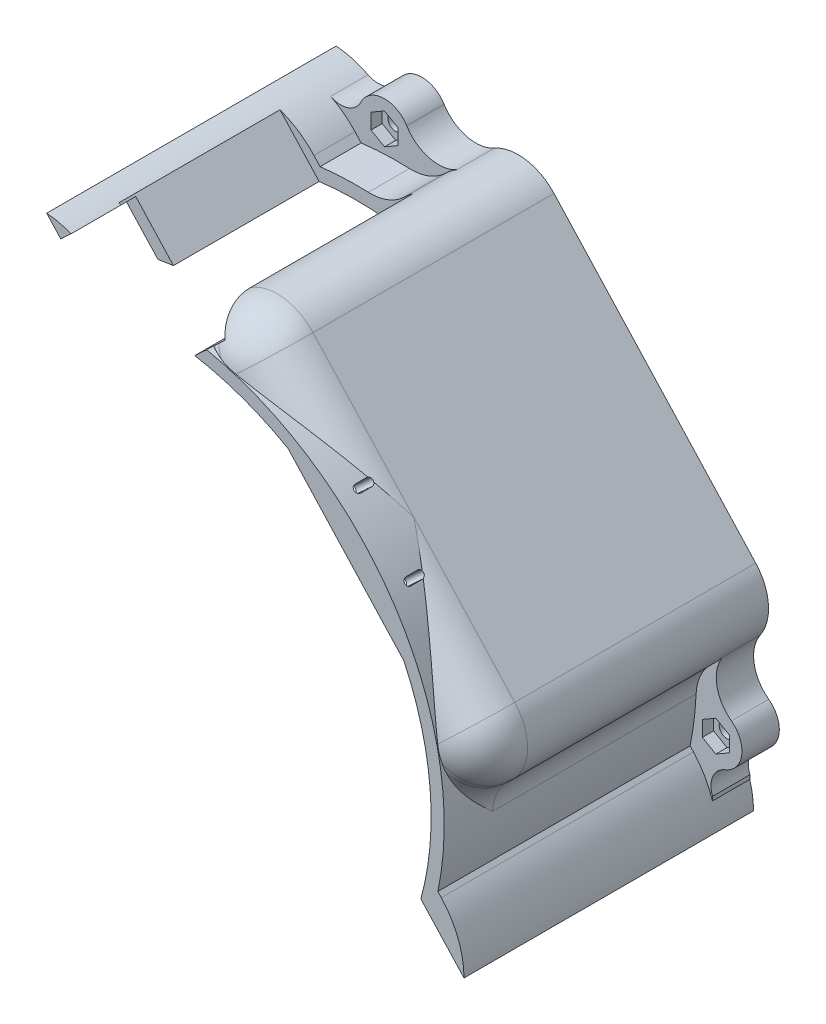
from build123d import *

# Parameters (mm, degrees)
SKETCH1_R               = 80
BOSS_EXTRUDE1_DEPTH     = 77.5
CUT_EXTRUDE1_DEPTH      = 136
BOSS_EXTRUDE3_DEPTH     = 77.5
BOSS_EXTRUDE4_DEPTH     = 30
FILLET4_R               = 13
FILLET5_R               = 13
BOSS_EXTRUDE5_DEPTH     = 60
CUT_EXTRUDE4_DEPTH      = 64
CUT_EXTRUDE5_DEPTH      = 59
SKETCH13_W              = 25
SKETCH13_H              = 43
CUT_EXTRUDE6_DEPTH      = 59
BOSS_EXTRUDE7_DEPTH     = 77.5
FILLET6_R               = 23
SKETCH15_W              = 25
SKETCH15_H              = 43.071374797
CUT_EXTRUDE7_DEPTH      = 59
CUT_EXTRUDE8_DEPTH      = 59
CUT_EXTRUDE9_DEPTH      = 84
CUT_EXTRUDE9_DEPTH_BACK = 59
CUT_EXTRUDE11_START     = -28.5
SKETCH18_W              = 30.45186069
SKETCH18_H              = 31
CUT_EXTRUDE11_DEPTH     = 28.5
BOSS_EXTRUDE8_START     = -10
SKETCH19_R              = 2.1
BOSS_EXTRUDE8_DEPTH     = 10
CUT_EXTRUDE12_DEPTH     = 3
CUT_EXTRUDE13_DEPTH     = 52
CUT_EXTRUDE15_START     = -74
CUT_EXTRUDE15_DEPTH     = 74
BOSS_EXTRUDE9_START     = -10
BOSS_EXTRUDE9_DEPTH     = 10


with BuildPart() as part:
    # Sketch1 → Boss-Extrude1 (new body)
    with BuildSketch(Plane.XY):
        Circle(SKETCH1_R)
    extrude(amount=-BOSS_EXTRUDE1_DEPTH)

    # Sketch2 → Cut-Extrude1 (cut)
    with BuildSketch(Plane.XY):
        Polygon((200.832620589, -158.529615693), (-139.779380555, 211.802473813), (-214.946113506, 22.839930093), (4.101583011, -190.386425583), align=None)
    extrude(amount=-CUT_EXTRUDE1_DEPTH, mode=Mode.SUBTRACT)

    # Sketch3 → Boss-Extrude3 (add)
    with BuildSketch(Plane(origin=(0, 0, -77.5), x_dir=(-1, 0, 0), z_dir=(0, 0, -1))):
        Polygon((-94.683885577, 15.230570574), (-23.079893303, 93.082366714), (-8.377765785, 79.560122175), (-79.981758059, 1.708326035), align=None)
    extrude(amount=-BOSS_EXTRUDE3_DEPTH)

    # Sketch7 → Boss-Extrude4 (add)
    with BuildSketch(Plane.XY):
        with BuildLine():
            Line((76.512778485, -23.362250072), (-16.894865428, 78.195674575))
            ThreePointArc((-16.894865428, 78.195674575), (58.88188944, 54.156468644), (76.512778485, -23.362250072))
        make_face()
    extrude(amount=-BOSS_EXTRUDE4_DEPTH)

    # Fillet4
    fillet4_edges = [part.edges().sort_by_distance(p)[0] for p in [
        (94.683885577, 15.230570574, -38.75),
        (79.981758059, 1.708326035, -38.75),
        (23.079893303, 93.082366714, -38.75),
        (8.377765785, 79.560122175, -38.75),
    ]]
    fillet(fillet4_edges, radius=FILLET4_R)

    # Fillet5
    # the kernel refuses this fillet: 13 mm, written as the material it takes off along each edge
    with BuildSketch(Plane(origin=(0, 0, 0), x_dir=(-0.5802553628668502, 0.8144345976591737, 0), z_dir=(-0.8144345976591737, -0.5802553628668502, 0))) as fillet5_piece_1:
        with BuildLine():
            CenterArc((80 - FILLET5_R, FILLET5_R), FILLET5_R, 270, 90)
            Line((80 - FILLET5_R, 0), (80, 0))
            Line((80, 0), (80, FILLET5_R))
        make_face()
    revolve(axis=Axis((0, 0, 0), (0, 0, -1)), revolution_arc=37.752557482, mode=Mode.SUBTRACT)
    with BuildSketch(Plane(origin=(13.511586269, 84.281940559, 0), x_dir=(0.6769558580513358, -0.7360236179973981, 0), z_dir=(-0.736023617997398, -0.6769558580513357, 0)), Plane(origin=(84.110809708, 5.506010829, 0), x_dir=(-0.676955858051335, 0.7360236179973988, 0), z_dir=(0.7360236179973989, 0.676955858051335, 0))) as fillet5_piece_2:
        with BuildLine():
            CenterArc((FILLET5_R, -FILLET5_R), FILLET5_R, 90, 90)
            Line((0, -FILLET5_R), (0, 0))
            Line((0, 0), (FILLET5_R, 0))
        make_face()
    extrude(amount=1.36513124, mode=Mode.SUBTRACT)
    with BuildSketch(Plane(origin=(0, 0, 0), x_dir=(0.999045546911454, -0.043680604350144224, 0), z_dir=(0.043680604350144224, 0.999045546911454, 0))) as fillet5_piece_3:
        with BuildLine():
            CenterArc((80 - FILLET5_R, FILLET5_R), FILLET5_R, 270, 90)
            Line((80, FILLET5_R), (80, 0))
            Line((80, 0), (80 - FILLET5_R, 0))
        make_face()
    revolve(axis=Axis((0, 0, 0), (0, 0, -1)), revolution_arc=37.752557482, mode=Mode.SUBTRACT)
    with BuildSketch(Plane(origin=(85.883459422, 24.798877608, 0), x_dir=(-0.7360236179973982, -0.6769558580513356, 0), z_dir=(-0.6769558580513355, 0.7360236179973983, 0))) as fillet5_piece_4:
        with BuildLine():
            CenterArc((FILLET5_R, -FILLET5_R), FILLET5_R, 90, 90)
            Line((0, -FILLET5_R), (0, 0))
            Line((0, 0), (FILLET5_R, 0))
        make_face()
    extrude(amount=39.886751797, mode=Mode.SUBTRACT)
    with BuildSketch(Plane(origin=(76.315152388, 15.998451454, 0), x_dir=(0.7360236179973981, 0.6769558580513357, 0), z_dir=(-0.6769558580513357, 0.7360236179973981, 0))) as fillet5_piece_5:
        with BuildLine():
            CenterArc((13 - FILLET5_R, FILLET5_R), FILLET5_R, 270, 90)
            Line((13, FILLET5_R), (13, 0))
            Line((13, 0), (13 - FILLET5_R, 0))
        make_face()
    revolve(axis=Axis((76.315152388, 15.998451454, 0), (0, 0, -1)), revolution_arc=90, mode=Mode.SUBTRACT)
    with BuildSketch(Plane(origin=(22.312012424, 74.713633525, 0), x_dir=(-0.6769558580513356, 0.7360236179973982, 0), z_dir=(-0.7360236179973982, -0.6769558580513356, 0))) as fillet5_piece_6:
        with BuildLine():
            CenterArc((13 - FILLET5_R, FILLET5_R), FILLET5_R, 270, 90)
            Line((13, FILLET5_R), (13, 0))
            Line((13, 0), (13 - FILLET5_R, 0))
        make_face()
    revolve(axis=Axis((22.312012424, 74.713633525, 0), (0, 0, -1)), revolution_arc=90, mode=Mode.SUBTRACT)
    with BuildSketch(Plane(origin=(3.70639128, 92.926114003, 0), x_dir=(-0.03985366967250139, -0.9992055269130747, 0), z_dir=(-0.9992055269130747, 0.03985366967250139, 0))) as fillet5_piece_7:
        with BuildLine():
            CenterArc((13 + FILLET5_R, -FILLET5_R), FILLET5_R, 90, 90)
            Line((13 + FILLET5_R, 0), (13, 0))
            Line((13, 0), (13, -FILLET5_R))
        make_face()
    revolve(axis=Axis((3.70639128, 92.926114003, 0), (0, 0, 1)), revolution_arc=44.890270577, mode=Mode.SUBTRACT)
    with BuildSketch(Plane(origin=(92.911235863, -4.062296205, 0), x_dir=(-0.6769558580513347, 0.7360236179973989, 0), z_dir=(0.7360236179973989, 0.6769558580513347, 0))) as fillet5_piece_8:
        with BuildLine():
            CenterArc((13 + FILLET5_R, -FILLET5_R), FILLET5_R, 90, 90)
            Line((13, -FILLET5_R), (13, 0))
            Line((13, 0), (13 + FILLET5_R, 0))
        make_face()
    revolve(axis=Axis((92.911235863, -4.062296205, 0), (0, 0, 1)), revolution_arc=44.890270577, mode=Mode.SUBTRACT)
    with BuildSketch(Plane(origin=(58.881889134, 54.156468976, 0), x_dir=(-0.7360236179973983, -0.6769558580513355, 0), z_dir=(-0.6769558580513355, 0.7360236179973983, 0))) as fillet5_piece_9:
        with BuildLine():
            CenterArc((FILLET5_R, -FILLET5_R), FILLET5_R, 90, 90)
            Line((0, -FILLET5_R), (0, 0))
            Line((0, 0), (FILLET5_R, 0))
        make_face()
    extrude(amount=39.886750895, mode=Mode.SUBTRACT)

    # Sketch8 → Boss-Extrude5 (add)
    with BuildSketch(Plane.XY):
        with BuildLine():
            Line((76.512778485, -23.362250072), (-16.894865428, 78.195674575))
            ThreePointArc((-16.894865428, 78.195674575), (58.88188944, 54.156468644), (76.512778485, -23.362250072))
        make_face()
    extrude(amount=-BOSS_EXTRUDE5_DEPTH)

    # Sketch11 → Cut-Extrude4 (cut)
    with BuildSketch(Plane(origin=(0, 0, -77.5), x_dir=(-1, 0, 0), z_dir=(0, 0, -1))):
        Polygon((-58.901596867, -9.002725987), (-85.208171513, 15.192679401), (-22.251276714, 83.642875875), (4.819019891, 58.74503915), align=None)
    extrude(amount=-CUT_EXTRUDE4_DEPTH, mode=Mode.SUBTRACT)

    # Sketch12 → Cut-Extrude5 (cut)
    with BuildSketch(Plane(origin=(0, 0, -13.5), x_dir=(-1, 0, 0), z_dir=(0, 0, -1))):
        with BuildLine():
            Line((-66.017136448, 30.149422801), (-73.14823909, 22.396096045))
            ThreePointArc((-73.14823909, 22.396096045), (-75.069436362, 14.725139196), (-76.188474546, 6.896835965))
            Line((-76.188474546, 6.896835965), (-57.965768686, -9.863451585))
            Line((-57.965768686, -9.863451585), (-41.718828093, 7.801115247))
            Line((-41.718828093, 7.801115247), (-66.017136448, 30.149422801))
        make_face()
    extrude(amount=-CUT_EXTRUDE5_DEPTH, mode=Mode.SUBTRACT)

    # Sketch13 → Cut-Extrude6 (cut)
    with BuildSketch(Plane(origin=(-31.478447399, 34.225098237, 0), x_dir=(0.7360236179973982, 0.6769558580513356, 0), z_dir=(0.6769558580513356, -0.7360236179973982, 0))):
        with Locations((56.5, -35)):
            Rectangle(SKETCH13_W, SKETCH13_H)
    extrude(amount=-CUT_EXTRUDE6_DEPTH, mode=Mode.SUBTRACT)

    # Sketch14 → Boss-Extrude7 (add)
    with BuildSketch(Plane.XY):
        with BuildLine():
            Line((76.512778485, -23.362250072), (85.289803009, -32.905113567))
            Line((85.289803009, -32.905113567), (89.773193917, -28.781526138))
            Line((89.773193917, -28.781526138), (78.316574767, -16.325260081))
            ThreePointArc((78.316574767, -16.325260081), (77.494593129, -19.864240127), (76.512778485, -23.362250072))
        make_face()
        with BuildLine():
            Line((-16.894865428, 78.195674575), (-26.407913569, 88.538783403))
            Line((-26.407913569, 88.538783403), (-21.924522662, 92.662370832))
            Line((-21.924522662, 92.662370832), (-9.731879894, 79.405859442))
            ThreePointArc((-9.731879894, 79.405859442), (-13.327116285, 78.882114396), (-16.894865428, 78.195674575))
        make_face()
    extrude(amount=-BOSS_EXTRUDE7_DEPTH)

    # Fillet6
    # the kernel refuses this fillet: 23 mm, written as the material it takes off along each edge
    with BuildSketch(Plane(origin=(-21.924522662, 92.662370832, 38.97901461), x_dir=(0.6769558580513366, -0.7360236179973972, 0), z_dir=(0, 0, -1))) as fillet6_piece_1:
        with BuildLine():
            CenterArc((15.591605844, 23), FILLET6_R, 227.320560267, 42.679439733)
            Line((0, 6.091368263), (0, 0))
            Line((0, 0), (15.591605844, 0))
        make_face()
    extrude(amount=155.458029219, mode=Mode.SUBTRACT)
    with BuildSketch(Plane(origin=(89.773193917, -28.781526138, 38.97901461), x_dir=(-0.7360236179973998, -0.676955858051334, 0), z_dir=(0, 0, -1))) as fillet6_piece_2:
        with BuildLine():
            CenterArc((23, 15.591605844), FILLET6_R, 180, 42.679439733)
            Line((0, 15.591605844), (0, 0))
            Line((0, 0), (6.091368263, 0))
        make_face()
    extrude(amount=155.458029219, mode=Mode.SUBTRACT)

    # Sketch15 → Cut-Extrude7 (cut)
    with BuildSketch(Plane(origin=(-31.478447399, 34.225098237, 0), x_dir=(0.7360236179973982, 0.6769558580513356, 0), z_dir=(0.6769558580513356, -0.7360236179973982, 0))):
        with Locations((56.5, -34.964312601)):
            Rectangle(SKETCH15_W, SKETCH15_H)
    extrude(amount=-CUT_EXTRUDE7_DEPTH, mode=Mode.SUBTRACT)

    # Sketch16 → Cut-Extrude8 (cut)
    with BuildSketch(Plane(origin=(0, 0, -13.5), x_dir=(-1, 0, 0), z_dir=(0, 0, -1))):
        with BuildLine():
            Line((-66.017136448, 30.149422801), (-28.423020194, 71.023812366))
            ThreePointArc((-28.423020194, 71.023812366), (-20.939173384, 73.578536395), (-13.231579747, 75.347032439))
            Line((-13.231579747, 75.347032439), (1.66949087, 61.641810488))
            Line((1.66949087, 61.641810488), (-45.040463335, 10.856180846))
            Line((-45.040463335, 10.856180846), (-66.017136448, 30.149422801))
        make_face()
    extrude(amount=-CUT_EXTRUDE8_DEPTH, mode=Mode.SUBTRACT)

    # Sketch17 → Cut-Extrude9 (cut, two sides: drawn at the far end of the back side and taken through both)
    with BuildSketch(Plane(origin=(0, 0, -13.5), x_dir=(-1, 0, 0), z_dir=(0, 0, -1)).offset(-CUT_EXTRUDE9_DEPTH_BACK)):
        with BuildLine():
            Line((-28.423020194, 71.023812366), (-73.14823909, 22.396096045))
            ThreePointArc((-73.14823909, 22.396096045), (56.305806777, -51.787123141), (-28.423020194, 71.023812366))
        make_face()
    extrude(amount=CUT_EXTRUDE9_DEPTH + CUT_EXTRUDE9_DEPTH_BACK, mode=Mode.SUBTRACT)

    # Sketch18 → Cut-Extrude11 (cut)
    with BuildSketch(Plane(origin=(29.808956529, 27.416712251, 0), x_dir=(0, 0, 1), z_dir=(-0.7360236179973981, -0.6769558580513358, 0)).offset(CUT_EXTRUDE11_START)):
        with Locations((-2.274069655, 62)):
            Rectangle(SKETCH18_W, SKETCH18_H)
    extrude(amount=CUT_EXTRUDE11_DEPTH, mode=Mode.SUBTRACT)

    # Sketch19 → Boss-Extrude8 (add)
    # profile 1 of 2: a face of its own
    with BuildSketch(Plane(origin=(0, 0, -77.5), x_dir=(-1, 0, 0), z_dir=(0, 0, -1)).offset(BOSS_EXTRUDE8_START)):
        with BuildLine():
            Line((-12.506817434, 83.357806969), (-13.511586269, 84.281940559))
            ThreePointArc((-13.511586269, 84.281940559), (-14.656973337, 85.220791875), (-15.901710733, 86.023276855))
            ThreePointArc((-15.901710733, 86.023276855), (-8.488680014, 85.035921923), (-2.463796082, 89.466347165))
            ThreePointArc((-2.463796082, 89.466347165), (3.841793272, 92.777895372), (9.784271839, 88.851859571))
            ThreePointArc((9.784271839, 88.851859571), (13.268034187, 85.791421665), (17.892902769, 86.128276048))
            ThreePointArc((17.892902769, 86.128276048), (14.409741659, 83.949890752), (11.369693749, 81.186580688))
            Line((11.369693749, 81.186580688), (9.731879894, 79.405859442))
            ThreePointArc((9.731879894, 79.405859442), (3.282531034, 79.932627819), (-3.188293574, 79.936442153))
            ThreePointArc((-3.188293574, 79.936442153), (-8.186980017, 80.722658567), (-12.506817434, 83.357806969))
        make_face()
        with Locations((3.491043263, 85.786688435)):
            Circle(SKETCH19_R, mode=Mode.SUBTRACT)
    # profile 2 of 2: a face of its own
    with BuildSketch(Plane(origin=(0, 0, -77.5), x_dir=(-1, 0, 0), z_dir=(0, 0, -1)).offset(BOSS_EXTRUDE8_START)):
        with BuildLine():
            Line((-78.316574767, -16.325260081), (-79.954388622, -18.105981328))
            ThreePointArc((-79.954388622, -18.105981328), (-82.454330439, -21.366052602), (-84.334405384, -25.018872337))
            ThreePointArc((-84.334405384, -25.018872337), (-84.384724905, -20.38202554), (-87.725245087, -17.165846877))
            ThreePointArc((-87.725245087, -17.165846877), (-92.133551316, -11.571774584), (-89.359831253, -5.011798544))
            ThreePointArc((-89.359831253, -5.011798544), (-85.447709812, 1.361834646), (-87.050322766, 8.666595144))
            ThreePointArc((-87.050322766, 8.666595144), (-86.146749966, 7.493177262), (-85.115578543, 6.43014442))
            Line((-85.115578543, 6.43014442), (-84.110809708, 5.506010829))
            ThreePointArc((-84.110809708, 5.506010829), (-81.124315089, 1.42117885), (-79.923643753, -3.494448348))
            ThreePointArc((-79.923643753, -3.494448348), (-79.379777789, -9.942377896), (-78.316574767, -16.325260081))
        make_face()
        with Locations(Location((-85.196010835, -10.638751497, 0), (0, 0, 180))):
            Circle(SKETCH19_R, mode=Mode.SUBTRACT)
    extrude(amount=BOSS_EXTRUDE8_DEPTH)

    # Sketch20 → Cut-Extrude12 (cut)
    with BuildSketch(Plane.XY.offset(-67.5)):
        Polygon((0.108956737, 87.865149404), (-3.491043263, 89.943610373), (-7.091043263, 87.865149404), (-7.091043263, 83.708227466), (-3.491043263, 81.629766497), (0.108956737, 83.708227466), align=None)
        Polygon((88.796010835, -8.560290528), (85.196010835, -6.481829559), (81.596010835, -8.560290528), (81.596010835, -12.717212466), (85.196010835, -14.795673435), (88.796010835, -12.717212466), align=None)
    extrude(amount=-CUT_EXTRUDE12_DEPTH, mode=Mode.SUBTRACT)

    # Sketch21 → Cut-Extrude13 (cut)
    with BuildSketch(Plane(origin=(50.785629642, 46.709954206, 0), x_dir=(0, 0, 1), z_dir=(-0.7360236179973983, -0.6769558580513356, 0))):
        with BuildLine():
            Line((-5.25, 8.994925081), (-8.25, 8.994925081))
            ThreePointArc((-8.25, 8.994925081), (-9.25, 9.994925081), (-8.25, 10.994925081))
            Line((-8.25, 10.994925081), (-5.25, 10.994925081))
            ThreePointArc((-5.25, 10.994925081), (-4.25, 9.994925081), (-5.25, 8.994925081))
        make_face()
        with BuildLine():
            Line((-5.25, -8.994925081), (-8.25, -8.994925081))
            ThreePointArc((-8.25, -8.994925081), (-9.25, -9.994925081), (-8.25, -10.994925081))
            Line((-8.25, -10.994925081), (-5.25, -10.994925081))
            ThreePointArc((-5.25, -10.994925081), (-4.25, -9.994925081), (-5.25, -8.994925081))
        make_face()
    extrude(amount=-CUT_EXTRUDE13_DEPTH, mode=Mode.SUBTRACT)

    # Sketch23 → Cut-Extrude15 (cut)
    with BuildSketch(Plane(origin=(0, 0, -13.5), x_dir=(-1, 0, 0), z_dir=(0, 0, -1)).offset(CUT_EXTRUDE15_START)):
        with BuildLine():
            Line((-38.244590063, 66.254066523), (-69.214858164, 32.581488752))
            ThreePointArc((-69.214858164, 32.581488752), (56.305806777, -51.787123141), (-38.244590063, 66.254066523))
        make_face()
    extrude(amount=CUT_EXTRUDE15_DEPTH, mode=Mode.SUBTRACT)

    # Sketch24 → Boss-Extrude9 (add)
    with BuildSketch(Plane(origin=(0, 0, -77.5), x_dir=(-1, 0, 0), z_dir=(0, 0, -1)).offset(BOSS_EXTRUDE9_START)):
        with BuildLine():
            Line((-79.954388622, -18.105981328), (-79.218365004, -17.305735994))
            ThreePointArc((-79.218365004, -17.305735994), (-82.24352695, -21.436767525), (-84.279791328, -26.134708956))
            ThreePointArc((-84.279791328, -26.134708956), (-84.307781358, -25.576824075), (-84.334405384, -25.018872337))
            ThreePointArc((-84.334405384, -25.018872337), (-82.454330439, -21.366052602), (-79.954388622, -18.105981328))
        make_face()
    extrude(amount=BOSS_EXTRUDE9_DEPTH)


solid = part.part
